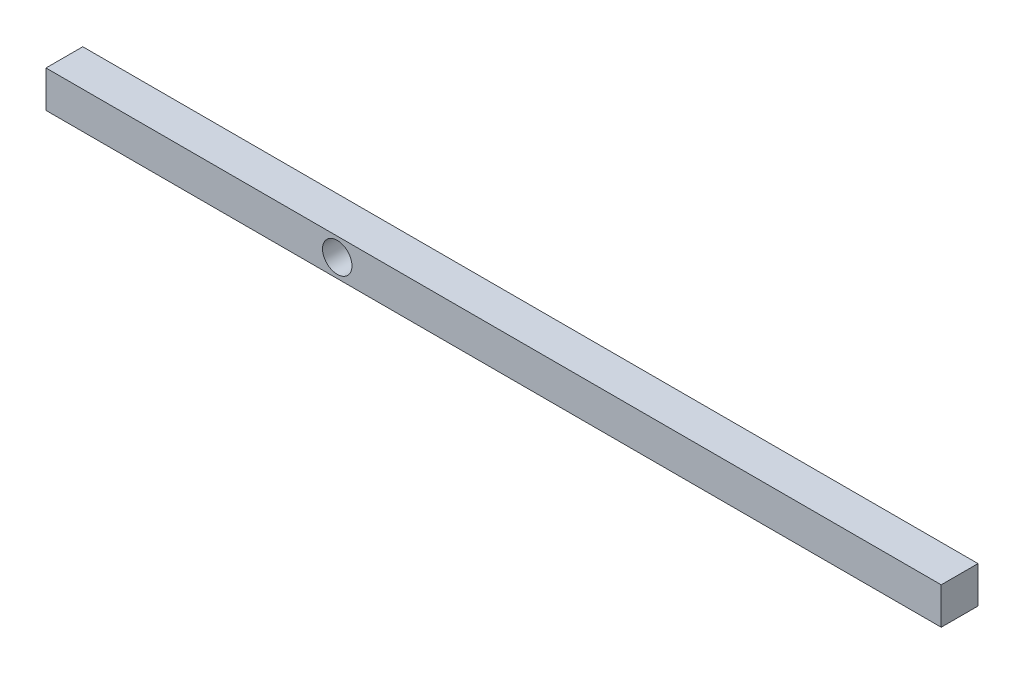
from build123d import *

# Parameters (mm, degrees)
SKETCH1_W           = 292
SKETCH1_H           = 12
BOSS_EXTRUDE1_DEPTH = 6
SKETCH2_R           = 4.8
CUT_EXTRUDE1_DEPTH  = 12


with BuildPart() as part:
    # Sketch1 → Boss-Extrude1 (new, symmetric)
    with BuildSketch(Plane.XY):
        with Locations((51, 0)):
            Rectangle(SKETCH1_W, SKETCH1_H)
    extrude(amount=BOSS_EXTRUDE1_DEPTH, both=True)

    # Sketch2 → Cut-Extrude1 (cut, symmetric)
    with BuildSketch(Plane.XY):
        Circle(SKETCH2_R)
    extrude(amount=CUT_EXTRUDE1_DEPTH, both=True, mode=Mode.SUBTRACT)


solid = part.part
